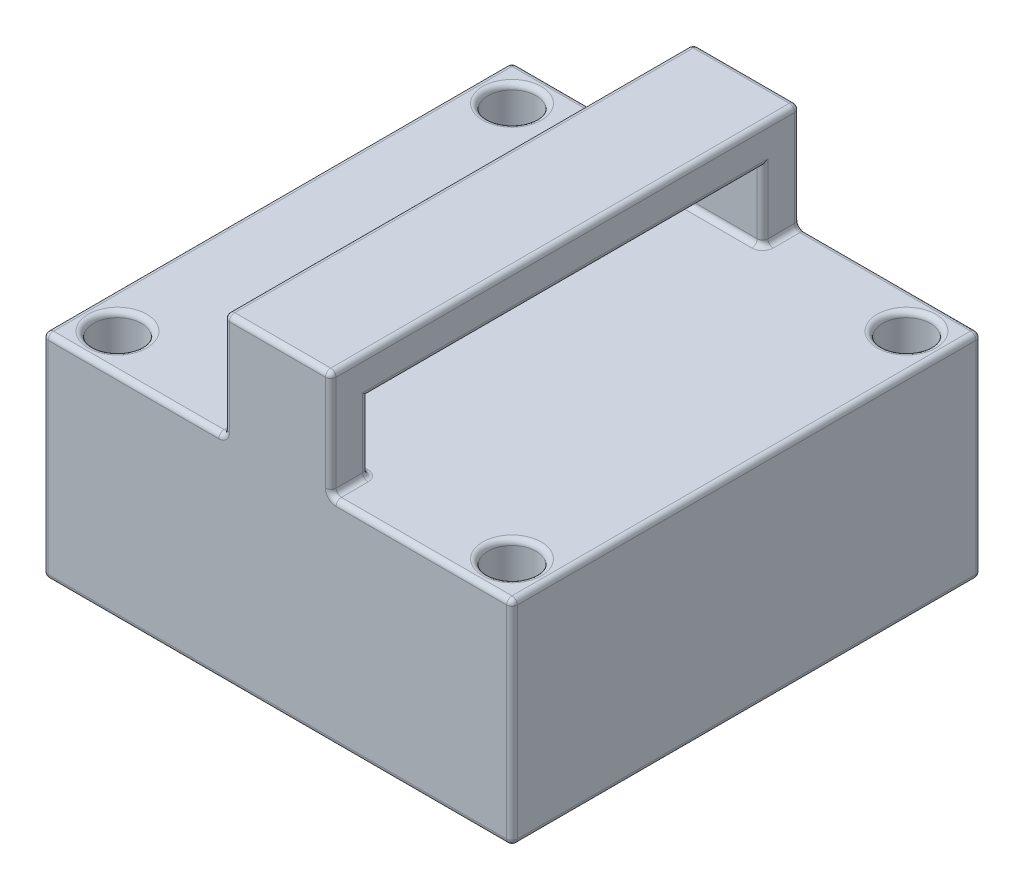
from build123d import *

# Parameters (mm, degrees)
SKETCH1_W                = 22
SKETCH1_H                = 22
SKETCH1_R                = 1.125
BOSS_EXTRUDE1_DEPTH      = 10
BOSS_EXTRUDE2_DEPTH      = 2.5
BOSS_EXTRUDE2_DEPTH_BACK = 2.5
FILLET1_R                = 0.25
FILLET2_R                = 0.25
SKETCH3_R                = 10.25
CUT_EXTRUDE1_DEPTH       = 3
SKETCH4_R                = 6
CUT_EXTRUDE2_DEPTH       = 0.25
CUT_EXTRUDE4_DEPTH       = 5.75
SKETCH6_W                = 14.3
SKETCH6_H                = 5.75
CUT_EXTRUDE5_DEPTH       = 10
CUT_EXTRUDE6_START       = -3
CUT_EXTRUDE6_DEPTH       = 3


# Read off the part's stored shape, not the designer's step: Cut-Extrude6
with BuildPart() as part:
    # Sketch1 → Boss-Extrude1 (new body)
    with BuildSketch(Plane(origin=(0, 0, 0), x_dir=(1, 0, 0), z_dir=(0, 1, 0))):
        with Locations((11, 11)):
            Rectangle(SKETCH1_W, SKETCH1_H)
        with Locations(Location((1.75, 20.25, 0), (0, 0, 270))):
            Circle(SKETCH1_R, mode=Mode.SUBTRACT)
        with Locations(Location((1.75, 1.75, 0), (0, 0, 270))):
            Circle(SKETCH1_R, mode=Mode.SUBTRACT)
        with Locations(Location((20.25, 1.75, 0), (0, 0, 90))):
            Circle(SKETCH1_R, mode=Mode.SUBTRACT)
        with Locations(Location((20.25, 20.25, 0), (0, 0, 90))):
            Circle(SKETCH1_R, mode=Mode.SUBTRACT)
    extrude(amount=BOSS_EXTRUDE1_DEPTH)

    # Sketch2 → Boss-Extrude2 (add, two sides: drawn at the far end of the back side and taken through both)
    with BuildSketch(Plane.ZY.offset(-11).offset(-BOSS_EXTRUDE2_DEPTH_BACK)):
        Polygon((-22, 10), (-22, 15), (0, 15), (0, 10), (-1.75, 10), (-1.75, 13.25), (-20.25, 13.25), (-20.25, 10), align=None)
    extrude(amount=BOSS_EXTRUDE2_DEPTH + BOSS_EXTRUDE2_DEPTH_BACK)

    # Fillet1
    fillet1_edges = [part.edges().sort_by_distance(p)[0] for p in [
        (17.75, 10, -22),
        (4.25, 10, -22),
        (17.75, 10, 0),
        (13.5, 11.625, -20.25),
        (11, 10, -20.25),
        (13.5, 10, -21.125),
        (8.5, 12.5, -22),
        (11, 15, -22),
        (8.5, 15, -11),
        (11, 15, 0),
        (8.5, 12.5, 0),
        (13.5, 10, -0.875),
        (11, 10, -1.75),
        (13.5, 11.625, -1.75),
        (13.5, 13.25, -11),
        (13.5, 12.5, -22),
        (13.5, 15, -11),
        (13.5, 12.5, 0),
        (8.5, 11.625, -20.25),
        (8.5, 13.25, -11),
        (8.5, 11.625, -1.75),
        (8.5, 10, -0.875),
        (8.5, 10, -21.125),
        (4.25, 10, 0),
    ]]
    fillet(fillet1_edges, radius=FILLET1_R)

    # Fillet2
    fillet2_edges = [part.edges().sort_by_distance(p)[0] for p in [
        (1.75, 10, -21.375),
        (1.75, 10, -2.875),
        (20.25, 10, -0.625),
        (20.25, 10, -19.125),
        (11, 0, -22),
        (22, 0, -11),
        (11, 0, 0),
        (0, 10, -11),
        (22, 10, -11),
        (0, 0, -11),
        (0, 4.875, -22),
        (22, 4.875, -22),
        (22, 4.875, 0),
        (22, 9.926776695, -0.073223305),
        (22, 9.926776695, -21.926776695),
        (0, 4.875, 0),
        (0, 9.926776695, -21.926776695),
        (0, 9.926776695, -0.073223305),
    ]]
    fillet(fillet2_edges, radius=FILLET2_R)

    # Sketch3 → Cut-Extrude1 (cut)
    with BuildSketch(Plane.XZ):
        with Locations(Location((11, -11, 0), (0, 0, 270))):
            Circle(SKETCH3_R)
    extrude(amount=-CUT_EXTRUDE1_DEPTH, mode=Mode.SUBTRACT)

    # Sketch4 → Cut-Extrude2 (cut)
    with BuildSketch(Plane.XZ.offset(-3)):
        with Locations(Location((11, -11, 0), (0, 0, 270))):
            Circle(SKETCH4_R)
    extrude(amount=-CUT_EXTRUDE2_DEPTH, mode=Mode.SUBTRACT)

    # Sketch5 → Cut-Extrude4 (cut)
    with BuildSketch(Plane(origin=(0, 9, 0), x_dir=(1, 0, 0), z_dir=(0, 1, 0))):
        with BuildLine():
            Line((11, 18.15), (0.25, 18.15))
            Line((0.25, 18.15), (0.25, 3.85))
            Line((0.25, 3.85), (11, 3.85))
            ThreePointArc((11, 3.85), (18.15, 11), (11, 18.15))
        make_face()
    extrude(amount=-CUT_EXTRUDE4_DEPTH, mode=Mode.SUBTRACT)

    # Sketch6 → Cut-Extrude5 (cut)
    with BuildSketch(Plane(origin=(0.25, 0, 0), x_dir=(0, 0, -1), z_dir=(1, 0, 0))):
        with Locations((11, 6.125)):
            Rectangle(SKETCH6_W, SKETCH6_H)
    extrude(amount=-CUT_EXTRUDE5_DEPTH, mode=Mode.SUBTRACT)

    # Cut-Extrude6 outline → Cut-Extrude6 (cut)
    with BuildSketch(Plane.XZ.offset(CUT_EXTRUDE6_START)):
        with BuildLine():
            Line((19, -22), (19, -17.408002809))
            ThreePointArc((19, -17.408002809), (11, -21.25), (3, -17.408002809))
            Line((3, -17.408002809), (3, -22))
            Line((3, -22), (19, -22))
        make_face()
    extrude(amount=CUT_EXTRUDE6_DEPTH, mode=Mode.SUBTRACT)


solid = part.part
